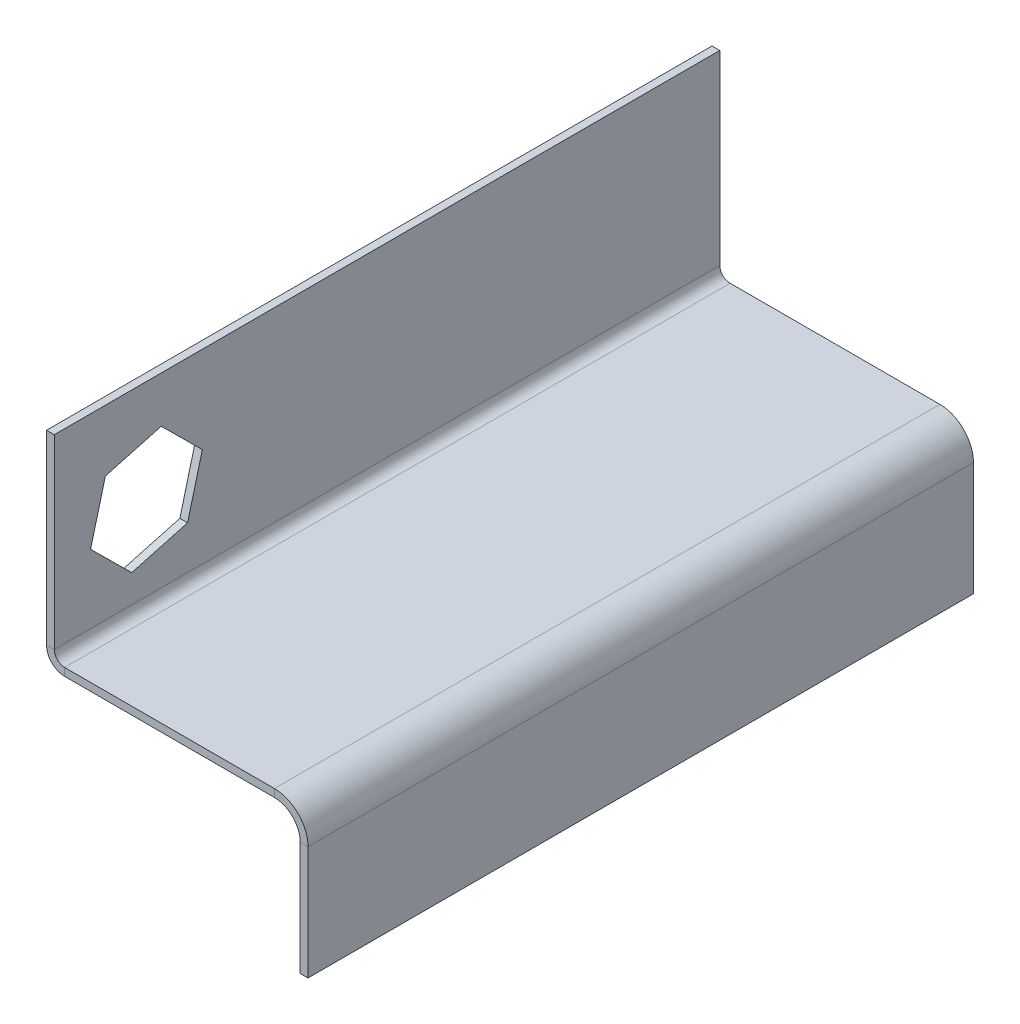
from build123d import *

# Parameters (mm, degrees)
BASE_FLANGE1_DEPTH           = 257.539224292
CUT_EXTRUDE1_DEPTH           = 10
EDGE_FLANGE1_STRIP_W         = 32
EDGE_FLANGE1_STRIP_H         = 3
EDGE_FLANGE1_STRIP_CUT_DEPTH = 257.539224292
EDGE_FLANGE1_DEPTH           = 257.539224292


# Sheet-metal steps are written as plain solids
with BuildPart() as part:
    # Sketch1 → Base-Flange1 (new body)
    with BuildSketch(Plane.XY):
        with BuildLine():
            Line((-53.840389348, 45.270638794), (-53.840389348, -26.739322638))
            ThreePointArc((-53.840389348, -26.739322638), (-52.668816472, -29.567749763), (-49.840389348, -30.739322638))
            Line((-49.840389348, -30.739322638), (44.339144169, -30.739322638))
            Line((44.339144169, -30.739322638), (44.339144169, -33.739322638))
            Line((44.339144169, -33.739322638), (-49.840389348, -33.739322638))
            ThreePointArc((-49.840389348, -33.739322638), (-54.790136816, -31.689070106), (-56.840389348, -26.739322638))
            Line((-56.840389348, -26.739322638), (-56.840389348, 45.270638794))
            Line((-56.840389348, 45.270638794), (-53.840389348, 45.270638794))
        make_face()
    extrude(amount=BASE_FLANGE1_DEPTH)

    # Sketch8 → Cut-Extrude1 (cut)
    with BuildSketch(Plane(origin=(-53.840389348, 0, 0), x_dir=(0, 0, -1), z_dir=(1, 0, 0))):
        Polygon((-216.16259768, 27.390589149), (-237.787839878, 21.496921555), (-243.496395119, -0.177921348), (-227.579708162, -15.959096657), (-205.954465965, -10.065429063), (-200.245910723, 11.60941384), align=None)
    extrude(amount=-CUT_EXTRUDE1_DEPTH, mode=Mode.SUBTRACT)

    # Edge-Flange1 strip (across the edge) → Edge-Flange1 strip cut (cut)
    with BuildSketch(Plane(origin=(44.339144169, -33.739322638, 0), x_dir=(-1, 0, 0), z_dir=(0, 0, 1))):
        with Locations((-3, -1.5)):
            Rectangle(EDGE_FLANGE1_STRIP_W, EDGE_FLANGE1_STRIP_H)
    extrude(amount=EDGE_FLANGE1_STRIP_CUT_DEPTH, mode=Mode.SUBTRACT)

    # Edge-Flange1 section (across the edge) → Edge-Flange1 (add)
    with BuildSketch(Plane(origin=(44.339144169, -33.739322638, 0), x_dir=(-1, 0, 0), z_dir=(0, 0, 1))):
        with BuildLine():
            Line((0, 10), (0, 54))
            Line((0, 54), (3, 54))
            Line((3, 54), (3, 10))
            ThreePointArc((3, 10), (5.928932188, 2.928932188), (13, 0))
            Line((13, 0), (13, -3))
            ThreePointArc((13, -3), (3.807611845, 0.807611845), (0, 10))
        make_face()
    extrude(amount=EDGE_FLANGE1_DEPTH)


solid = part.part
